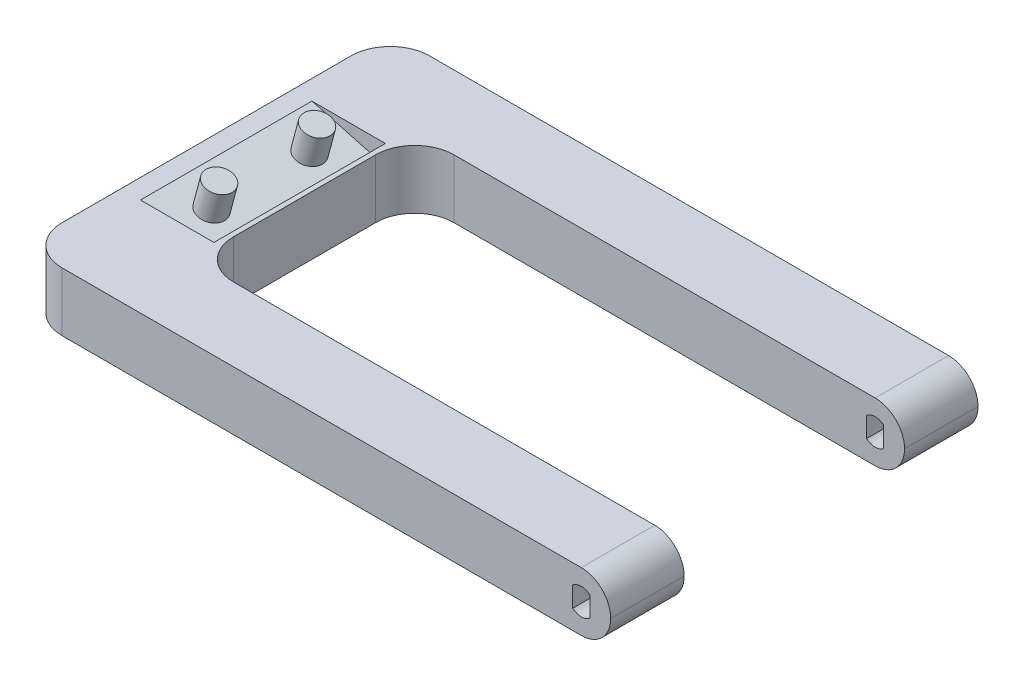
from build123d import *

# Parameters (mm, degrees)
BOSS_EXTRUDE1_DEPTH = 6
FILLET1_R           = 6
FILLET2_R           = 8
CUT_EXTRUDE1_DEPTH  = 17.5
SKETCH5_R           = 2.75
BOSS_EXTRUDE2_DEPTH = 6
CUT_EXTRUDE2_DEPTH  = 104.140903424


with BuildPart() as part:
    # Sketch1 → Boss-Extrude1 (new, symmetric)
    with BuildSketch(Plane(origin=(0, 0, 0), x_dir=(1, 0, 0), z_dir=(0, 1, 0))):
        Polygon((50, 37.5), (50, 22.5), (-50, 22.5), (-50, -22.5), (50, -22.5), (50, -37.5), (-70, -37.5), (-70, 37.5), align=None)
    extrude(amount=BOSS_EXTRUDE1_DEPTH, both=True)

    # Fillet1
    fillet1_edges = [part.edges().sort_by_distance(p)[0] for p in [
        (50, 6, -30),
        (50, -6, -30),
        (50, -6, 30),
        (50, 6, 30),
    ]]
    fillet(fillet1_edges, radius=FILLET1_R - 0.0001)  # a hair under: the kernel refuses the full size

    # Fillet2
    fillet2_edges = [part.edges().sort_by_distance(p)[0] for p in [
        (-50, 0, -22.5),
        (-50, 0, 22.5),
        (-70, 0, 37.5),
        (-70, 0, -37.5),
    ]]
    fillet(fillet2_edges, radius=FILLET2_R)

    # Sketch4 → Cut-Extrude1 (cut, symmetric)
    with BuildSketch(Plane.XY):
        Polygon((-66, 6), (-51, 1.980762114), (-51, 6), align=None)
    extrude(amount=CUT_EXTRUDE1_DEPTH, both=True, mode=Mode.SUBTRACT)

    # Sketch5 → Boss-Extrude2 (add)
    with BuildSketch(Plane(origin=(-2.921161675, -10.901923789, 0), x_dir=(0.9659258262890701, -0.25881904510251424, 0), z_dir=(0.25881904510251424, 0.9659258262890701, 0))):
        with Locations((-58.059575109, 10)):
            Circle(SKETCH5_R)
        with Locations((-58.059575109, -10)):
            Circle(SKETCH5_R)
    extrude(amount=BOSS_EXTRUDE2_DEPTH)

    # Sketch6 → Cut-Extrude2 (cut, through all)
    with BuildSketch(Plane.XY.offset(37.5)):
        with BuildLine():
            Line((42.25, -2.056088519), (42.25, 2.056088519))
            ThreePointArc((42.25, 2.056088519), (44, 2.7), (45.75, 2.056088519))
            Line((45.75, 2.056088519), (45.75, -2.056088519))
            ThreePointArc((45.75, -2.056088519), (44, -2.7), (42.25, -2.056088519))
        make_face()
    extrude(amount=-CUT_EXTRUDE2_DEPTH, mode=Mode.SUBTRACT)


solid = part.part
